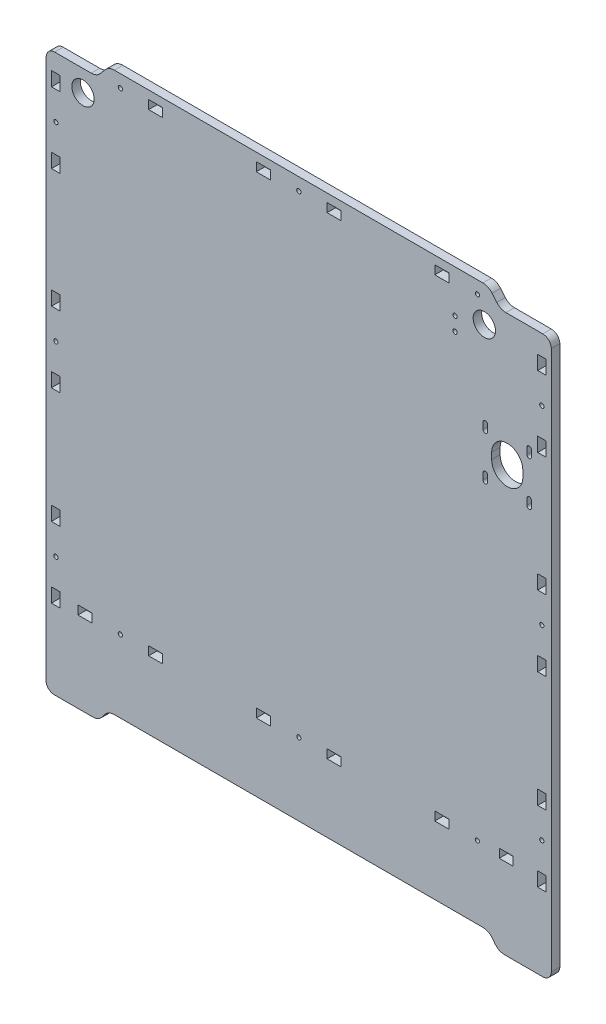
from build123d import *

# Parameters (mm, degrees)
SKETCH_1_R      = 1.55
SKETCH_1_R_2    = 7.9
SKETCH_1_R_3    = 1.500000001
SKETCH_1_R_4    = 1.5
SKETCH_1_W      = 6
SKETCH_1_H      = 10
SKETCH_1_W_2    = 9.994814166
SKETCH_1_H_2    = 6.199822499
SKETCH_1_W_3    = 9.849167249
SKETCH_1_W_4    = 9.971716679
SKETCH_1_H_3    = 6.19978722
SKETCH_1_W_5    = 9.976438663
SKETCH_1_W_6    = 9.849167498
SKETCH_1_W_7    = 9.949996322
SKETCH_1_W_8    = 9.96963529
SKETCH_1_H_4    = 6.199787221
SKETCH_1_W_9    = 9.974357274
SKETCH_1_W_10   = 6.021531284
SKETCH_1_W_11   = 6.011865173
SKETCH_1_W_12   = 9.973103266
EXTRUDE_1_DEPTH = 6


with BuildPart() as part:
    # Эскиз1 → Бобышка-Вытянуть1 (new body)
    with BuildSketch(Plane.XY):
        with BuildLine():
            Line((146.640626227, 193.939219199), (172.677011129, 193.939642374))
            ThreePointArc((172.677011129, 193.939642374), (176.915749493, 192.186191961), (178.677011134, 187.950693325))
            Line((178.677011134, 187.950693325), (178.677011134, -193.360357626))
            ThreePointArc((178.677011134, -193.360357626), (176.919651821, -197.602998313), (172.677011134, -199.360357626))
            Line((172.677011134, -199.360357626), (145.640626228, -199.360357626))
            ThreePointArc((145.640626228, -199.360357626), (142.048371003, -198.563973816), (139.129248462, -196.324052308))
            Line((139.129248462, -196.324052308), (136.833422409, -193.304399213))
            ThreePointArc((136.833422409, -193.304399213), (133.914299867, -191.064477706), (130.322044642, -190.268093896))
            Line((130.322044642, -190.268093896), (-129.968022374, -190.268093896))
            ThreePointArc((-129.968022374, -190.268093896), (-133.560277599, -191.064477706), (-136.479400141, -193.304399213))
            Line((-136.479400141, -193.304399213), (-138.775226194, -196.324052308))
            ThreePointArc((-138.775226194, -196.324052308), (-141.694348736, -198.563973816), (-145.28660396, -199.360357626))
            Line((-145.28660396, -199.360357626), (-172.322988866, -199.360357626))
            ThreePointArc((-172.322988866, -199.360357626), (-175.943358295, -198.147372213), (-178.098901308, -194.995857859))
            Line((-178.098901308, -194.995857859), (-178.098901308, 187.939642374))
            ThreePointArc((-178.098901308, 187.939642374), (-176.341541996, 192.182283061), (-172.098901308, 193.939642374))
            Line((-172.098901308, 193.939642374), (-146.286603961, 193.939642374))
            ThreePointArc((-146.286603961, 193.939642374), (-142.694348737, 194.736026184), (-139.775226195, 196.975947692))
            Line((-139.775226195, 196.975947692), (-136.479400142, 200.903337056))
            ThreePointArc((-136.479400142, 200.903337056), (-133.5602776, 203.143258564), (-129.968022375, 203.939642374))
            Line((-129.968022375, 203.939642374), (130.322044641, 203.939642374))
            ThreePointArc((130.322044641, 203.939642374), (133.914299866, 203.143258564), (136.833422408, 200.903337056))
            Line((136.833422408, 200.903337056), (140.129248461, 196.975524517))
            ThreePointArc((140.129248461, 196.975524517), (143.048371002, 194.735603009), (146.640626227, 193.939219199))
        make_face()
        with Locations((110.677011134, 164.31981119)):
            Circle(SKETCH_1_R, mode=Mode.SUBTRACT)
        with Locations((110.677011134, 174.01981119)):
            Circle(SKETCH_1_R, mode=Mode.SUBTRACT)
        with Locations((131.377011134, 179.01981119)):
            Circle(SKETCH_1_R_2, mode=Mode.SUBTRACT)
        with Locations((-152.122988866, 179.01981119)):
            Circle(SKETCH_1_R_2, mode=Mode.SUBTRACT)
        with Locations((-171.241452607, 151.539642374)):
            Circle(SKETCH_1_R_3, mode=Mode.SUBTRACT)
        with Locations((-171.241452607, 17.379642374)):
            Circle(SKETCH_1_R_4, mode=Mode.SUBTRACT)
        with Locations((171.987715265, 149.67420525)):
            Circle(SKETCH_1_R_4, mode=Mode.SUBTRACT)
        with Locations((126.462093852, 195.057081698)):
            Circle(SKETCH_1_R_4, mode=Mode.SUBTRACT)
        with Locations((-125.710663701, 195.057081698)):
            Circle(SKETCH_1_R_4, mode=Mode.SUBTRACT)
        with Locations((0.358090643, 195.057081698)):
            Circle(SKETCH_1_R_4, mode=Mode.SUBTRACT)
        with Locations((-125.74954067, -139.065910363)):
            Circle(SKETCH_1_R_4, mode=Mode.SUBTRACT)
        with Locations((-171.241452606, -114.321504357)):
            Circle(SKETCH_1_R_4, mode=Mode.SUBTRACT)
        with Locations((0.375695716, -139.065910363)):
            Circle(SKETCH_1_R_4, mode=Mode.SUBTRACT)
        with Locations((126.442808867, -139.065910363)):
            Circle(SKETCH_1_R_4, mode=Mode.SUBTRACT)
        with Locations((171.987715265, -116.21234228)):
            Circle(SKETCH_1_R_4, mode=Mode.SUBTRACT)
        with Locations((171.987715265, 15.509293857)):
            Circle(SKETCH_1_R_4, mode=Mode.SUBTRACT)
        with BuildLine():
            Line((133.65547985, 83.46981119), (133.65547985, 87.96981119))
            ThreePointArc((133.65547985, 87.96981119), (132.05547985, 89.56981119), (130.45547985, 87.96981119))
            Line((130.45547985, 87.96981119), (130.45547985, 83.46981119))
            ThreePointArc((130.45547985, 83.46981119), (132.05547985, 81.86981119), (133.65547985, 83.46981119))
        make_face(mode=Mode.SUBTRACT)
        with BuildLine():
            Line((133.65547985, 118.96981119), (133.65547985, 114.46981119))
            ThreePointArc((133.65547985, 114.46981119), (132.05547985, 112.86981119), (130.45547985, 114.46981119))
            Line((130.45547985, 114.46981119), (130.45547985, 118.96981119))
            ThreePointArc((130.45547985, 118.96981119), (132.05547985, 120.56981119), (133.65547985, 118.96981119))
        make_face(mode=Mode.SUBTRACT)
        with BuildLine():
            Line((158.55547985, 98.96981119), (158.55547985, 103.46981119))
            ThreePointArc((158.55547985, 103.46981119), (147.55547985, 114.46981119), (136.55547985, 103.46981119))
            Line((136.55547985, 103.46981119), (136.55547985, 98.96981119))
            ThreePointArc((136.55547985, 98.96981119), (147.55547985, 87.96981119), (158.55547985, 98.96981119))
        make_face(mode=Mode.SUBTRACT)
        with BuildLine():
            Line((161.45547985, 118.96981119), (161.45547985, 114.46981119))
            ThreePointArc((161.45547985, 114.46981119), (163.05547985, 112.86981119), (164.65547985, 114.46981119))
            Line((164.65547985, 114.46981119), (164.65547985, 118.96981119))
            ThreePointArc((164.65547985, 118.96981119), (163.05547985, 120.56981119), (161.45547985, 118.96981119))
        make_face(mode=Mode.SUBTRACT)
        with BuildLine():
            Line((161.45547985, 83.46981119), (161.45547985, 87.96981119))
            ThreePointArc((161.45547985, 87.96981119), (163.05547985, 89.56981119), (164.65547985, 87.96981119))
            Line((164.65547985, 87.96981119), (164.65547985, 83.46981119))
            ThreePointArc((164.65547985, 83.46981119), (163.05547985, 81.86981119), (161.45547985, 83.46981119))
        make_face(mode=Mode.SUBTRACT)
        with Locations((-171.345073779, 42.379642374)):
            Rectangle(SKETCH_1_W, SKETCH_1_H, mode=Mode.SUBTRACT)
        with Locations((101.375242683, -139.100475893)):
            Rectangle(SKETCH_1_W_2, SKETCH_1_H_2, mode=Mode.SUBTRACT)
        with Locations((146.834619429, -139.100475893)):
            Rectangle(SKETCH_1_W_3, SKETCH_1_H_2, mode=Mode.SUBTRACT)
        with Locations((-24.705755079, 195.005248414)):
            Rectangle(SKETCH_1_W_4, SKETCH_1_H_3, mode=Mode.SUBTRACT)
        with Locations((25.291923766, 195.005248414)):
            Rectangle(SKETCH_1_W_5, SKETCH_1_H_3, mode=Mode.SUBTRACT)
        with Locations((-150.741012535, -139.100475893)):
            Rectangle(SKETCH_1_W_6, SKETCH_1_H_2, mode=Mode.SUBTRACT)
        with Locations((-100.791387959, -139.100475893)):
            Rectangle(SKETCH_1_W_7, SKETCH_1_H_2, mode=Mode.SUBTRACT)
        with Locations((-24.706795773, -139.09908242)):
            Rectangle(SKETCH_1_W_8, SKETCH_1_H_4, mode=Mode.SUBTRACT)
        with Locations((25.290883071, -139.09908242)):
            Rectangle(SKETCH_1_W_9, SKETCH_1_H_4, mode=Mode.SUBTRACT)
        Polygon((-174.438677957, -12.611504357), (-174.438677957, -2.611504357), (-168.438677957, -2.628265083), (-168.438677957, -12.611504357), align=None, mode=Mode.SUBTRACT)
        with Locations((-171.34507378, 176.539642374)):
            Rectangle(SKETCH_1_W, SKETCH_1_H, mode=Mode.SUBTRACT)
        with Locations((-171.34507378, 126.539642374)):
            Rectangle(SKETCH_1_W, SKETCH_1_H, mode=Mode.SUBTRACT)
        with Locations((-171.438677957, -89.341504357)):
            Rectangle(SKETCH_1_W, SKETCH_1_H, mode=Mode.SUBTRACT)
        Polygon((-174.438677957, -144.319934452), (-174.438677957, -134.319934452), (-168.438677957, -134.341898452), (-168.438677957, -144.319934452), align=None, mode=Mode.SUBTRACT)
        with Locations((172.066245492, 40.421614562)):
            Rectangle(SKETCH_1_W_10, SKETCH_1_H, mode=Mode.SUBTRACT)
        with Locations((172.066245492, -9.578426536)):
            Rectangle(SKETCH_1_W_10, SKETCH_1_H, mode=Mode.SUBTRACT)
        with Locations((172.066245492, -91.299573267)):
            Rectangle(SKETCH_1_W_10, SKETCH_1_H, mode=Mode.SUBTRACT)
        with Locations((172.066245492, -141.299614366)):
            Rectangle(SKETCH_1_W_10, SKETCH_1_H, mode=Mode.SUBTRACT)
        Polygon((169.05547985, 169.743748976), (169.05547985, 179.593092862), (175.067345023, 179.593092862), (175.077011134, 169.81981119), (175.067345023, 169.743748976), align=None, mode=Mode.SUBTRACT)
        with Locations((172.061412437, 124.593228152)):
            Rectangle(SKETCH_1_W_11, SKETCH_1_H, mode=Mode.SUBTRACT)
        with Locations((-100.779834487, 195.002849525)):
            Rectangle(SKETCH_1_W_12, SKETCH_1_H_3, mode=Mode.SUBTRACT)
        Polygon((106.3778356, 191.902955915), (106.177011134, 191.91981119), (96.3778356, 191.902955915), (96.3778356, 198.102743135), (106.177011134, 198.11981119), (106.3778356, 198.102743135), align=None, mode=Mode.SUBTRACT)
    extrude(amount=EXTRUDE_1_DEPTH)


solid = part.part
